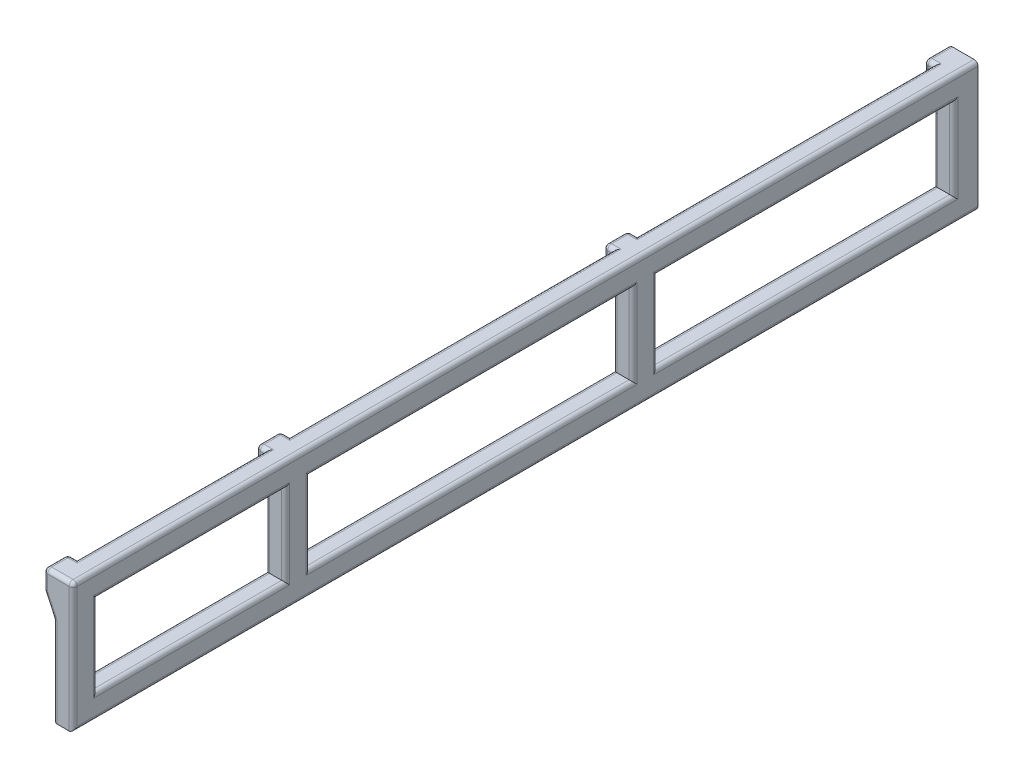
from build123d import *

# Parameters (mm, degrees)
ESBO_O8_W                = 80
ESBO_O8_H                = 20
ESBO_O8_W_2              = 73.38
ESBO_O8_W_3              = 46.62
RESSALTO_EXTRUS_O1_DEPTH = 5
RESSALTO_EXTRUS_O2_DEPTH = 6
RESSALTO_EXTRUS_O3_DEPTH = 6
RESSALTO_EXTRUS_O4_DEPTH = 6
RESSALTO_EXTRUS_O5_DEPTH = 6
FILETE1_R                = 1
FILETE2_R                = 1


with BuildPart() as part:
    # Esboço8 → Ressalto-extrusão1 (new body)
    with BuildSketch(Plane(origin=(0, 0, 0), x_dir=(0, 0, -1), z_dir=(1, 0, 0))):
        Polygon((95.558629268, 10), (-128.441370732, 10), (-128.441370732, 42), (70.171505342, 42), (95.558629268, 42), align=None)
        with Locations((-29.821370732, 26)):
            Rectangle(ESBO_O8_W, ESBO_O8_H, mode=Mode.SUBTRACT)
        with Locations((52.868629268, 26)):
            Rectangle(ESBO_O8_W_2, ESBO_O8_H, mode=Mode.SUBTRACT)
        with Locations((-99.131370732, 26)):
            Rectangle(ESBO_O8_W_3, ESBO_O8_H, mode=Mode.SUBTRACT)
    extrude(amount=-RESSALTO_EXTRUS_O1_DEPTH)

    # Esboço9 → Ressalto-extrusão2 (add)
    with BuildSketch(Plane.XY.offset(75.821370732)):
        Polygon((-7.299581581, 42), (-5, 42), (-5, 32.104391167), (-7.299581581, 37.035859781), align=None)
    extrude(amount=-RESSALTO_EXTRUS_O2_DEPTH)

    # Esboço10 → Ressalto-extrusão3 (add)
    with BuildSketch(Plane.XY.offset(-10.178629268)):
        Polygon((-5, 32.104391167), (-5, 36), (-5, 42), (-7.299581581, 42), (-7.299581581, 37.035859781), align=None)
    extrude(amount=-RESSALTO_EXTRUS_O3_DEPTH)

    # Esboço11 → Ressalto-extrusão4 (add)
    with BuildSketch(Plane.XY.offset(128.441370732)):
        Polygon((-5, 32.104391167), (-5, 36), (-5, 42), (-7.299581581, 42), (-7.299581581, 37.035859781), align=None)
    extrude(amount=-RESSALTO_EXTRUS_O4_DEPTH)

    # Esboço12 → Ressalto-extrusão5 (add)
    with BuildSketch(Plane.XY.offset(-89.558629268)):
        Polygon((-7.299581581, 42), (-7.299581581, 37.035859781), (-5, 32.104391167), (-5, 42), align=None)
    extrude(amount=-RESSALTO_EXTRUS_O5_DEPTH)

    # Filete1
    filete1_edges = [part.edges().sort_by_distance(p)[0] for p in [
        (-6.14979079, 34.570125474, 75.821370732),
        (-6.14979079, 34.570125474, 69.821370732),
        (-7.299581581, 37.035859781, 72.821370732),
        (-7.299581581, 39.51792989, 75.821370732),
        (-7.299581581, 39.51792989, 69.821370732),
        (-7.299581581, 37.035859781, 125.441370732),
        (-7.299581581, 37.035859781, -13.178629268),
        (-3.64979079, 42, 128.441370732),
        (-7.299581581, 42, 125.441370732),
        (-6.14979079, 42, 122.441370732),
        (-5, 42, 99.131370732),
        (-6.14979079, 42, 75.821370732),
        (-7.299581581, 42, 72.821370732),
        (-6.14979079, 42, 69.821370732),
        (-5, 42, 29.821370732),
        (-6.14979079, 42, -10.178629268),
        (-7.299581581, 42, -13.178629268),
        (-6.14979079, 42, -16.178629268),
        (-5, 42, -52.868629268),
        (-6.14979079, 42, -89.558629268),
        (0, 10, 16.441370732),
        (0, 26, 128.441370732),
        (0, 42, 16.441370732),
        (0, 26, -16.178629268),
        (0, 16, -52.868629268),
        (0, 26, -89.558629268),
        (0, 36, -52.868629268),
        (0, 26, 75.821370732),
        (0, 36, 99.131370732),
        (0, 26, 122.441370732),
        (0, 16, 99.131370732),
        (0, 36, 29.821370732),
        (0, 26, 69.821370732),
        (0, 16, 29.821370732),
        (0, 26, -10.178629268),
        (-5, 24.052195584, -89.558629268),
        (-5, 16, -52.868629268),
        (-5, 24.052195584, -16.178629268),
        (-5, 32.104391167, -13.178629268),
        (-5, 24.052195584, -10.178629268),
        (-5, 16, 29.821370732),
        (-5, 24.052195584, 69.821370732),
        (-5, 32.104391167, 72.821370732),
        (-5, 24.052195584, 75.821370732),
        (-5, 16, 99.131370732),
        (-5, 24.052195584, 122.441370732),
        (-5, 32.104391167, 125.441370732),
        (-5, 21.052195584, 128.441370732),
        (-5, 10, 16.441370732),
        (-5, 36, -52.868629268),
        (-5, 36, 29.821370732),
        (-5, 36, 99.131370732),
        (-6.14979079, 34.570125474, -89.558629268),
        (-6.14979079, 34.570125474, 128.441370732),
        (-6.14979079, 34.570125474, 122.441370732),
        (-6.14979079, 34.570125474, -10.178629268),
        (-6.14979079, 34.570125474, -16.178629268),
        (-7.299581581, 39.51792989, 128.441370732),
        (-7.299581581, 39.51792989, 122.441370732),
        (-7.299581581, 39.51792989, -10.178629268),
        (-7.299581581, 39.51792989, -16.178629268),
        (-7.299581581, 42, -92.558629268),
        (-5, 32.104391167, -92.558629268),
        (-7.299581581, 37.035859781, -92.558629268),
        (-7.299581581, 39.51792989, -89.558629268),
    ]]
    fillet(filete1_edges, radius=FILETE1_R)

    # Filete2
    # the kernel refuses this fillet: 1 mm, written as the material it takes off along each edge
    with BuildSketch(Plane(origin=(-6, 31.882696504, -95.558629268), x_dir=(-0.80118997671776, -0.5984100777953153, 0), z_dir=(-0.5984100777953153, 0.80118997671776, 0))) as filete2_piece_1:
        with BuildLine():
            CenterArc((1 + FILETE2_R, FILETE2_R), FILETE2_R, 180, 90)
            Line((1, FILETE2_R), (1, 0))
            Line((1, 0), (1 + FILETE2_R, 0))
        make_face()
    revolve(axis=Axis((-6, 31.882696504, -95.558629268), (0, 0, 1)), revolution_arc=168.243887481, mode=Mode.SUBTRACT)
    with BuildSketch(Plane(origin=(-6.299581581, 37.257554444, -95.558629268), x_dir=(-1, 0, 0), z_dir=(0, 1, 0))) as filete2_piece_2:
        with BuildLine():
            CenterArc((1 - FILETE2_R, FILETE2_R), FILETE2_R, 270, 90)
            Line((1, FILETE2_R), (1, 0))
            Line((1, 0), (1 - FILETE2_R, 0))
        make_face()
    revolve(axis=Axis((-6.299581581, 37.257554444, -95.558629268), (0, 0, 1)), revolution_arc=25, mode=Mode.SUBTRACT)
    with BuildSketch(Plane(origin=(-7.205889368, 36.834936182, -95.558629268), x_dir=(0.9063077870366507, 0.4226182617406979, 0), z_dir=(0.42261826174069794, -0.9063077870366507, 0))) as filete2_piece_3:
        with BuildLine():
            CenterArc((FILETE2_R, FILETE2_R), FILETE2_R, 180, 90)
            Line((0, FILETE2_R), (0, 0))
            Line((0, 0), (FILETE2_R, 0))
        make_face()
    extrude(amount=4.997884251, mode=Mode.SUBTRACT)
    with BuildSketch(Plane(origin=(-7.299581581, 43.5, -95.558629268), x_dir=(1, 0, 0), z_dir=(0, -1, 0))) as filete2_piece_4:
        with BuildLine():
            CenterArc((FILETE2_R, FILETE2_R), FILETE2_R, 180, 90)
            Line((0, FILETE2_R), (0, 0))
            Line((0, 0), (FILETE2_R, 0))
        make_face()
    extrude(amount=6.242445556, mode=Mode.SUBTRACT)


solid = part.part
